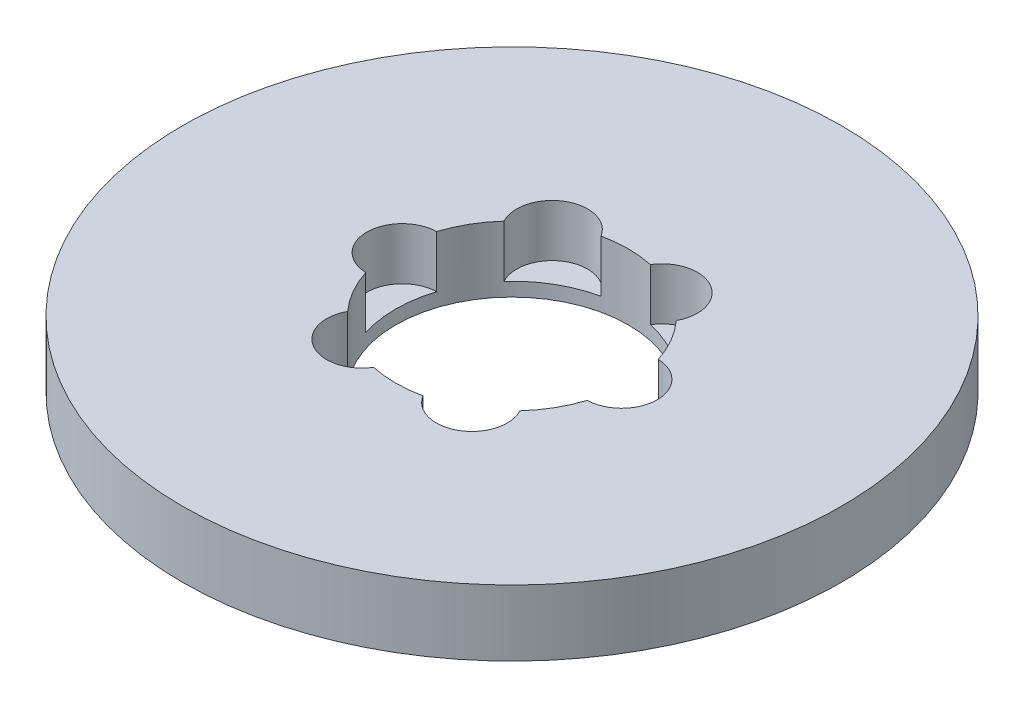
from build123d import *

# Parameters (mm, degrees)
SKETCH1_R           = 85
BOSS_EXTRUDE1_DEPTH = 17
SKETCH2_R           = 30
CUT_EXTRUDE1_DEPTH  = 122.404283285
SKETCH3_R           = 9.157387857
CUT_EXTRUDE2_DEPTH  = 13.44133084
CIRPATTERN1_COUNT   = 6


with BuildPart() as part:
    # Sketch1 → Boss-Extrude1 (new body)
    with BuildSketch(Plane(origin=(0, 0, 0), x_dir=(1, 0, 0), z_dir=(0, 1, 0))):
        Circle(SKETCH1_R)
    extrude(amount=BOSS_EXTRUDE1_DEPTH)

    # Sketch2 → Cut-Extrude1 (cut, through all)
    with BuildSketch(Plane(origin=(0, 0, 0), x_dir=(1, 0, 0), z_dir=(0, 1, 0))):
        Circle(SKETCH2_R)
    extrude(amount=CUT_EXTRUDE1_DEPTH, mode=Mode.SUBTRACT)

    # Sketch3 → Cut-Extrude2 (cut)
    with BuildSketch(Plane(origin=(0, 17, 0), x_dir=(1, 0, 0), z_dir=(0, 1, 0))):
        with Locations((-28.305359404, 0)):
            Circle(SKETCH3_R)
    cut_extrude2 = extrude(amount=-CUT_EXTRUDE2_DEPTH, mode=Mode.SUBTRACT)

    # CirPattern1: Cut-Extrude2 ×6 about axis
    cirpattern1_axis = Axis((0, 0, 0), (0, 1, 0))
    for i in range(1, CIRPATTERN1_COUNT):
        add(cut_extrude2.rotate(cirpattern1_axis, i * 360 / CIRPATTERN1_COUNT), mode=Mode.SUBTRACT)


solid = part.part
